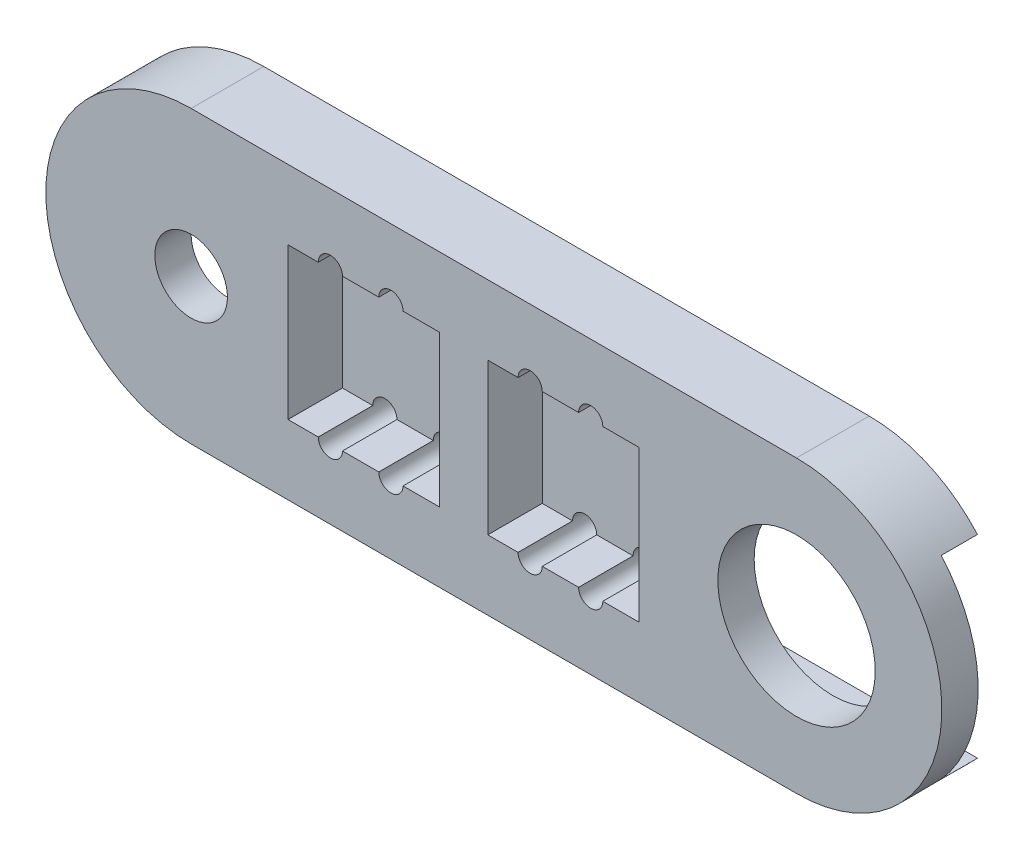
from build123d import *

# Parameters (mm, degrees)
EXTRUDE_1_DEPTH     = 6
SKETCH_4_W          = 12.5
SKETCH_4_H          = 12.5
CUT_EXTRUDE_1_DEPTH = 4.5
SKETCH_5_R          = 3
SKETCH_5_R_2        = 6.5
CUT_EXTRUDE_2_DEPTH = 64.372312566
SKETCH_6_R          = 1
CUT_EXTRUDE_3_DEPTH = 64.372312566
EXTRUDE_2_DEPTH     = 6
SKETCH_9_W          = 12
SKETCH_9_H          = 12
SKETCH_9_W_2        = 30
SKETCH_9_H_2        = 16
CUT_EXTRUDE_5_DEPTH = 3


with BuildPart() as part:
    # Эскиз1 → Бобышка-Вытянуть1 (new body)
    with BuildSketch(Plane.XY):
        with BuildLine():
            Line((0, 0), (50, 0))
            ThreePointArc((50, 0), (59.9, -9.9), (50, -19.8))
            Line((50, -19.8), (0, -19.8))
            ThreePointArc((0, -19.8), (-9.9, -9.9), (0, 0))
        make_face()
    extrude(amount=EXTRUDE_1_DEPTH)

    # Эскиз4 → Вырез-Вытянуть1 (cut)
    with BuildSketch(Plane.XY.offset(6)):
        with Locations((14.25, -9.9)):
            Rectangle(SKETCH_4_W, SKETCH_4_H)
        with Locations((30.75, -9.9)):
            Rectangle(SKETCH_4_W, SKETCH_4_H)
    extrude(amount=-CUT_EXTRUDE_1_DEPTH, mode=Mode.SUBTRACT)

    # Эскиз5 → Вырез-Вытянуть2 (cut, through all)
    with BuildSketch(Plane.XY.offset(6)):
        with Locations((0, -9.9)):
            Circle(SKETCH_5_R)
        with Locations((50, -9.9)):
            Circle(SKETCH_5_R_2)
    extrude(amount=-CUT_EXTRUDE_2_DEPTH, mode=Mode.SUBTRACT)

    # Эскиз6 → Вырез-Вытянуть3 (cut, through all)
    with BuildSketch(Plane.XY.offset(6)):
        with Locations((11.5, -3.65)):
            Circle(SKETCH_6_R)
        with Locations((16.5, -3.65)):
            Circle(SKETCH_6_R)
        with Locations((28, -3.65)):
            Circle(SKETCH_6_R)
        with Locations((33, -3.65)):
            Circle(SKETCH_6_R)
        with Locations((11.5, -16.15)):
            Circle(SKETCH_6_R)
        with Locations((16.5, -16.15)):
            Circle(SKETCH_6_R)
        with Locations((28, -16.15)):
            Circle(SKETCH_6_R)
        with Locations((33, -16.15)):
            Circle(SKETCH_6_R)
    extrude(amount=-CUT_EXTRUDE_3_DEPTH, mode=Mode.SUBTRACT)

    # Эскиз8 → Бобышка-Вытянуть2 (add)
    with BuildSketch(Plane.XY.offset(6)):
        with BuildLine():
            Line((0, 2.1), (50, 2.1))
            ThreePointArc((50, 2.1), (62, -9.9), (50, -21.9))
            Line((50, -21.9), (0, -21.9))
            ThreePointArc((0, -21.9), (-12, -9.9), (0, 2.1))
        make_face()
        with BuildLine():
            Line((0, -0.209438441), (50, -0.209438441))
            ThreePointArc((50, -0.209438441), (59.690561559, -9.9), (50, -19.590561559))
            Line((50, -19.590561559), (0, -19.590561559))
            ThreePointArc((0, -19.590561559), (-9.690561559, -9.9), (0, -0.209438441))
        make_face(mode=Mode.SUBTRACT)
    extrude(amount=-EXTRUDE_2_DEPTH)

    # Эскиз9 → Вырез-Вытянуть5 (cut)
    with BuildSketch(Plane(origin=(0, 0, 0), x_dir=(-1, 0, 0), z_dir=(0, 0, -1))):
        with Locations((0, -9.9)):
            Rectangle(SKETCH_9_W, SKETCH_9_H)
        with Locations((-50, -9.9)):
            Rectangle(SKETCH_9_W_2, SKETCH_9_H_2)
    extrude(amount=-CUT_EXTRUDE_5_DEPTH, mode=Mode.SUBTRACT)


solid = part.part
